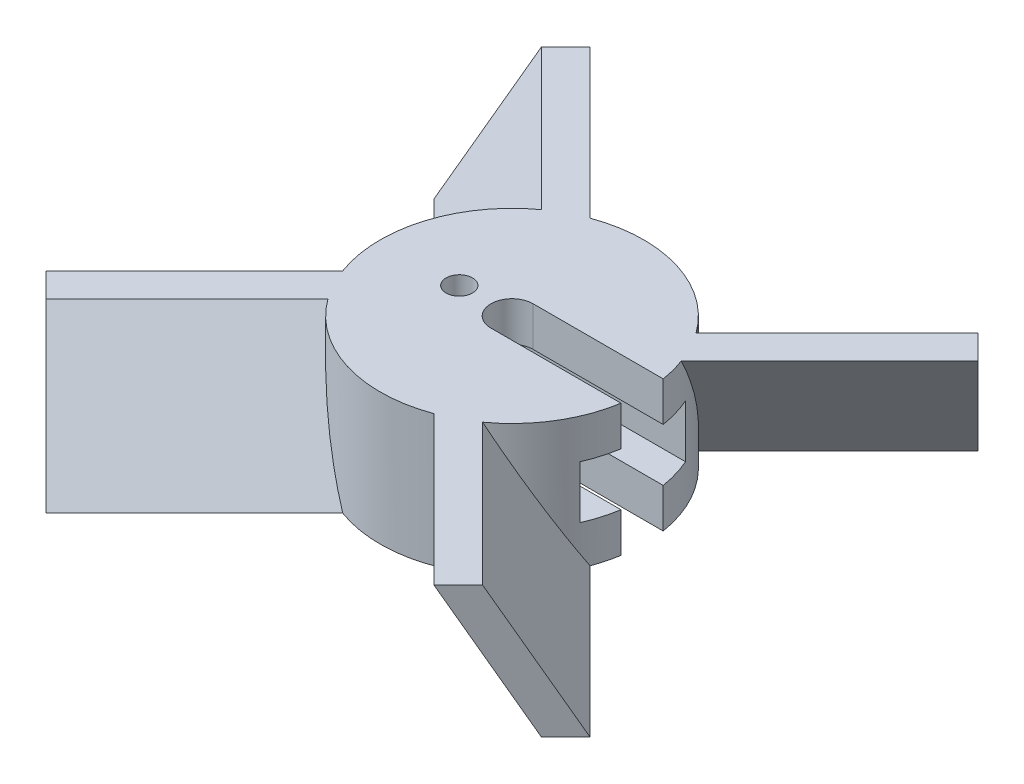
from build123d import *

# Parameters (mm, degrees)
SKETCH1_R           = 10
BOSS_EXTRUDE1_DEPTH = 10
SKETCH3_R           = 1.6
CUT_EXTRUDE2_DEPTH  = 18.320508076
SKETCH7_W           = 3.2
SKETCH7_H           = 10
CUT_EXTRUDE6_DEPTH  = 10
SKETCH9_R           = 1
CUT_EXTRUDE7_DEPTH  = 18.320508076
SKETCH10_W          = 8
SKETCH10_H          = 4
CUT_EXTRUDE8_DEPTH  = 17
FILLET1_R           = 4
BOSS_EXTRUDE3_START = -0.920608418
BOSS_EXTRUDE3_DEPTH = 15.920608418
CIRPATTERN2_COUNT   = 4


# Read off the part's stored shape, not the designer's step: Boss-Extrude3
with BuildPart() as part:
    # Sketch1 → Boss-Extrude1 (new body)
    with BuildSketch(Plane(origin=(0, 0, 0), x_dir=(1, 0, 0), z_dir=(0, 1, 0))):
        with Locations(Location((0, 0, 0), (0, 0, 270))):
            Circle(SKETCH1_R)
    extrude(amount=BOSS_EXTRUDE1_DEPTH)

    # Sketch3 → Cut-Extrude2 (cut, through all)
    with BuildSketch(Plane(origin=(0, 10, 0), x_dir=(1, 0, 0), z_dir=(0, 1, 0))):
        with Locations(Location((0, 0, 0), (0, 0, 270))):
            Circle(SKETCH3_R)
    extrude(amount=-CUT_EXTRUDE2_DEPTH, mode=Mode.SUBTRACT)

    # Sketch7 → Cut-Extrude6 (cut)
    with BuildSketch(Plane(origin=(10, 0, 0), x_dir=(0, 0, -1), z_dir=(1, 0, 0))):
        with Locations((0, 5)):
            Rectangle(SKETCH7_W, SKETCH7_H)
    extrude(amount=-CUT_EXTRUDE6_DEPTH, mode=Mode.SUBTRACT)

    # Sketch9 → Cut-Extrude7 (cut, through all)
    with BuildSketch(Plane(origin=(0, 10, 0), x_dir=(1, 0, 0), z_dir=(0, 1, 0))):
        with Locations(Location((-4, 0, 0), (0, 0, 270))):
            Circle(SKETCH9_R)
    extrude(amount=-CUT_EXTRUDE7_DEPTH, mode=Mode.SUBTRACT)

    # Sketch10 → Cut-Extrude8 (cut)
    with BuildSketch(Plane(origin=(10, 0, 0), x_dir=(0, 0, -1), z_dir=(1, 0, 0))):
        with Locations((0, 5)):
            Rectangle(SKETCH10_W, SKETCH10_H)
    extrude(amount=-CUT_EXTRUDE8_DEPTH, mode=Mode.SUBTRACT)

    # Fillet1
    fillet1_edges = [part.edges().sort_by_distance(p)[0] for p in [
        (-7, 5, 4),
        (-7, 5, -4),
    ]]
    fillet(fillet1_edges, radius=FILLET1_R - 0.0001)  # a hair under: the kernel refuses the full size

    # Boss-Extrude3 outline → Boss-Extrude3 (add)
    with BuildSketch(Plane(origin=(7.071067812, 0, 7.071067812), x_dir=(0.7071067811865476, 0, -0.7071067811865476), z_dir=(0.7071067811865476, 0, 0.7071067811865476)).offset(BOSS_EXTRUDE3_START)):
        Polygon((4.191019983, 0), (-1.582482709, 10), (-4.191019983, 10), (1.582482709, 0), align=None)
    boss_extrude3 = extrude(amount=BOSS_EXTRUDE3_DEPTH)

    # CirPattern2: Boss-Extrude3 ×4 about axis
    cirpattern2_axis = Axis((0, 0, 0), (0, 1, 0))
    for i in range(1, CIRPATTERN2_COUNT):
        add(boss_extrude3.rotate(cirpattern2_axis, i * 360 / CIRPATTERN2_COUNT))


solid = part.part
